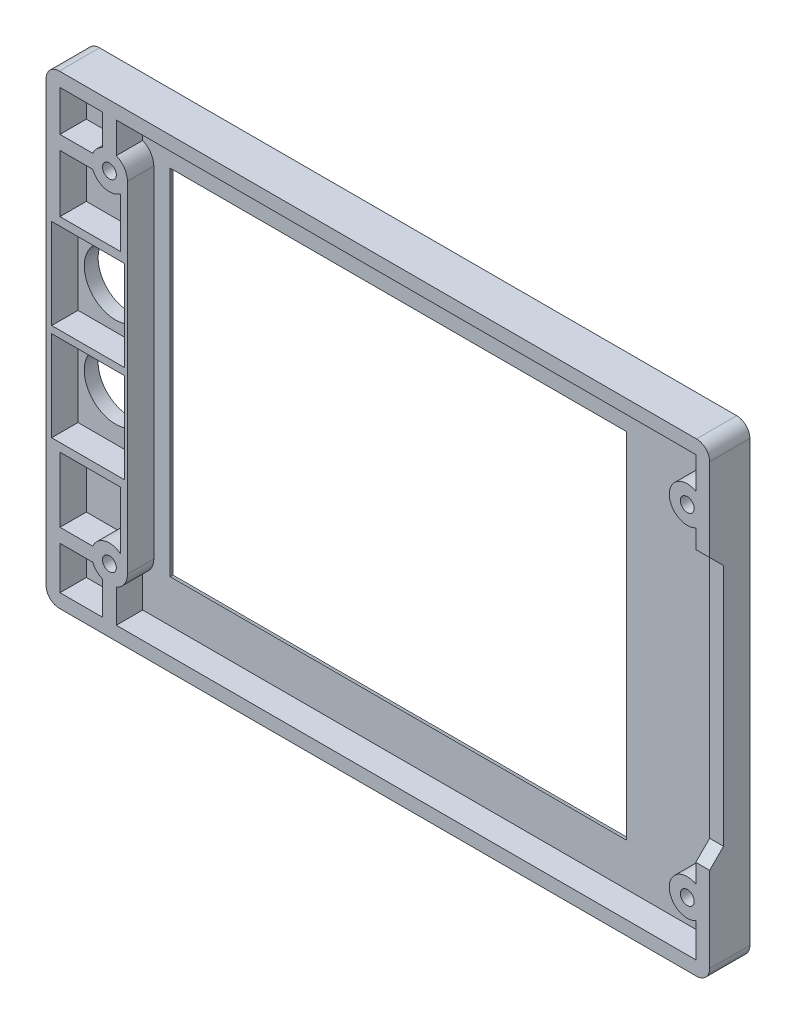
from build123d import *

# Parameters (mm, degrees)
AUFSATZ_LINEAR_AUSTRAGEN1_DEPTH       = 2
SKIZZE3_W                             = 65.8
SKIZZE3_H                             = 51
SCHNITT_LINEAR_AUSTRAGEN1_DEPTH       = 2
SKIZZE4_R                             = 2.6
SKIZZE4_R_2                           = 1
LINEAR_AUSTRAGEN_D_NN1_DEPTH          = 3.8
SKIZZE9_R                             = 4.5
SCHNITT_LINEAR_AUSTRAGEN3_DEPTH       = 2
SKIZZE14_W                            = 2
SKIZZE14_H                            = 51
AUFSATZ_LINEAR_AUSTRAGEN6_DEPTH       = 0.8
SKIZZE15_W                            = 2
SKIZZE15_H                            = 51
SCHNITT_LINEAR_AUSTRAGEN7_DEPTH       = 0.8
SCHNITT_LINEAR_START                  = -0.8
SCHNITT_LINEAR_AUSTRAGEN6_OUTLINE_W   = 0.832
SCHNITT_LINEAR_AUSTRAGEN6_OUTLINE_H   = 4.8
SCHNITT_LINEAR_AUSTRAGEN6_DEPTH       = 1.8
AUFSATZ_LINEAR_START                  = -0.8
AUFSATZ_LINEAR_AUSTRAGEN5_DEPTH       = 0.8
AUFSATZ_LINEAR_AUSTRAGEN5_2_OUTLINE_W = 0.832
AUFSATZ_LINEAR_AUSTRAGEN5_2_OUTLINE_H = 4.8
AUFSATZ_LINEAR_AUSTRAGEN5_2_DEPTH     = 0.8
AUFSATZ_LINEAR_AUSTRAGEN5_3_DEPTH     = 0.8
SKIZZE16_W                            = 69.8
SKIZZE16_H                            = 55
SKIZZE16_W_2                          = 65.8
SKIZZE16_H_2                          = 51
SCHNITT_LINEAR_AUSTRAGEN8_DEPTH       = 1.8
SKIZZE16_2_W                          = 69.8
SKIZZE16_2_H                          = 55
SKIZZE16_2_W_2                        = 65.8
SKIZZE16_2_H_2                        = 51
AUFSATZ_LINEAR_AUSTRAGEN7_DEPTH       = 1.8
FASE3_SIZE                            = 1.6
SKIZZE21_W                            = 95.25
SKIZZE21_H                            = 2
AUFSATZ_LINEAR_AUSTRAGEN12_DEPTH      = 0.2
SKIZZE22_W                            = 2
SKIZZE22_H                            = 66.875
AUFSATZ_LINEAR_AUSTRAGEN13_DEPTH      = 0.2
SKIZZE23_W                            = 95.45
SKIZZE23_H                            = 2
AUFSATZ_LINEAR_AUSTRAGEN14_DEPTH      = 0.2
SKIZZE24_W                            = 2
SKIZZE24_H                            = 67.075
AUFSATZ_LINEAR_AUSTRAGEN15_DEPTH      = 0.2
VERRUNDUNG1_R                         = 1.9
SKIZZE25_W                            = 91.65
SKIZZE25_H                            = 63.075
LINEAR_AUSTRAGEN_D_NN2_DEPTH          = 3.8
SKIZZE26_W                            = 6.123167254
SKIZZE26_H                            = 2
SKIZZE26_W_2                          = 2
SKIZZE26_H_2                          = 5.859879325
SKIZZE26_H_3                          = 6.16886128
SKIZZE26_W_3                          = 0.4
SKIZZE26_H_4                          = 49.045433533
AUFSATZ_LINEAR_AUSTRAGEN16_DEPTH      = 3.8
SKIZZE27_W                            = 1.2
SKIZZE27_H                            = 27.007076655
SCHNITT_LINEAR_AUSTRAGEN9_DEPTH       = 3.8
SKIZZE28_W                            = 9.523167254
SKIZZE28_H                            = 1.2
SKIZZE28_W_2                          = 9.323167254
AUFSATZ_LINEAR_AUSTRAGEN17_DEPTH      = 3.8
SKIZZE29_W                            = 10.523167254
SKIZZE29_H                            = 1.007076655
AUFSATZ_LINEAR_AUSTRAGEN18_DEPTH      = 3.8
SKIZZE32_W                            = 2
SKIZZE32_H                            = 35.046259395
SCHNITT_LINEAR_AUSTRAGEN10_DEPTH      = 2
FASE4_SIZE                            = 2
SKIZZE33_W                            = 0.6
SKIZZE33_H                            = 8.082666584
SKIZZE33_H_2                          = 9.131924744
AUFSATZ_LINEAR_AUSTRAGEN19_DEPTH      = 3.8


with BuildPart() as part:
    # Skizze2 → Aufsatz-Linear austragen1 (new body)
    with BuildSketch(Plane.XY):
        Polygon((-84.803910283, -35.982715869), (6.159856384, -35.982715869), (8.38232305, -35.982715869), (8.38232305, -33.918949203), (8.38232305, 28.628517464), (8.38232305, 30.692284131), (6.318589717, 30.692284131), (-84.803910283, 30.692284131), (-86.86767695, 30.692284131), (-86.86767695, 28.628517464), (-86.86767695, -33.918949203), (-86.86767695, -35.982715869), align=None)
    extrude(amount=AUFSATZ_LINEAR_AUSTRAGEN1_DEPTH)

    # Skizze3 → Schnitt-Linear austragen1 (cut)
    with BuildSketch(Plane(origin=(0, 0, 0), x_dir=(-1, 0, 0), z_dir=(0, 0, -1))):
        with Locations((39.27767695, -2.538949203)):
            Rectangle(SKIZZE3_W, SKIZZE3_H)
    extrude(amount=-SCHNITT_LINEAR_AUSTRAGEN1_DEPTH, mode=Mode.SUBTRACT)

    # Skizze4 → Linear-Austragen-Dünn1 (add)
    # profile 1 of 4: a face of its own
    with BuildSketch(Plane.XY.offset(2)):
        with Locations((-77.944509696, 22.032404806)):
            Circle(SKIZZE4_R)
        with Locations((-77.944509696, 22.032404806)):
            Circle(SKIZZE4_R_2, mode=Mode.SUBTRACT)
    # profile 2 of 4: a face of its own
    with BuildSketch(Plane.XY.offset(2)):
        with Locations((-77.944509696, -27.013854589)):
            Circle(SKIZZE4_R)
        with Locations((-77.944509696, -27.013854589)):
            Circle(SKIZZE4_R_2, mode=Mode.SUBTRACT)
    # profile 3 of 4: a face of its own
    with BuildSketch(Plane.XY.offset(2)):
        with Locations((5.358600488, -27.013854589)):
            Circle(SKIZZE4_R)
        with Locations((5.358600488, -27.013854589)):
            Circle(SKIZZE4_R_2, mode=Mode.SUBTRACT)
    # profile 4 of 4: a face of its own
    with BuildSketch(Plane.XY.offset(2)):
        with Locations((5.358600488, 22.032404806)):
            Circle(SKIZZE4_R)
        with Locations((5.358600488, 22.032404806)):
            Circle(SKIZZE4_R_2, mode=Mode.SUBTRACT)
    extrude(amount=LINEAR_AUSTRAGEN_D_NN1_DEPTH)

    # Skizze9 → Schnitt-Linear austragen3 (cut)
    with BuildSketch(Plane.XY.offset(2)):
        with Locations((-80.86767695, 4.567589342)):
            Circle(SKIZZE9_R)
        with Locations((-80.86767695, -8.439487313)):
            Circle(SKIZZE9_R)
    extrude(amount=-SCHNITT_LINEAR_AUSTRAGEN3_DEPTH, mode=Mode.SUBTRACT)

    # Skizze14 → Aufsatz-Linear austragen6 (add)
    with BuildSketch(Plane.ZY.offset(6.37767695)):
        with Locations((1, -2.538949203)):
            Rectangle(SKIZZE14_W, SKIZZE14_H)
    extrude(amount=AUFSATZ_LINEAR_AUSTRAGEN6_DEPTH)

    # Skizze15 → Schnitt-Linear austragen7 (cut)
    with BuildSketch(Plane(origin=(-72.17767695, 0, 0), x_dir=(0, 0, -1), z_dir=(1, 0, 0))):
        with Locations((-1, -2.538949203)):
            Rectangle(SKIZZE15_W, SKIZZE15_H)
    extrude(amount=-SCHNITT_LINEAR_AUSTRAGEN7_DEPTH, mode=Mode.SUBTRACT)

    # Schnitt-Linear austragen6: read off the stored shape, not the designer's step
    # Schnitt-Linear austragen6 outline → Schnitt-Linear austragen6 (cut)
    # profile 1 of 3: a face of its own
    with BuildSketch(Plane(origin=(0, 0, 0), x_dir=(-1, 0, 0), z_dir=(0, 0, -1)).offset(SCHNITT_LINEAR_START)):
        with BuildLine():
            add(Edge.make_bspline(
                [(41.781767782, -34.797276997), (41.767178521, -34.762910345), (41.737075659, -34.691999652), (41.68900459, -34.583021504), (41.636856474, -34.468236667), (41.581670084, -34.346987974), (41.523757347, -34.218948594), (41.462532171, -34.08419863), (41.399774132, -33.94193969), (41.312065058, -33.743850082), (41.200314409, -33.493806205), (41.056118353, -33.201433241), (40.914209117, -32.917053322), (40.800807681, -32.685582439), (40.715021172, -32.506824871), (40.652268758, -32.382022082), (40.592207512, -32.263881564), (40.542395149, -32.171631198), (40.511571239, -32.10832599), (40.500095841, -32.082007826), (40.496573283, -32.07324744)],
                knots=[0, 0, 0, 0, 0.034500563, 0.071187, 0.110063316, 0.15100446, 0.194290954, 0.239922853, 0.287774458, 0.337971758, 0.440120704, 0.540825287, 0.639182399, 0.733823363, 0.779010204, 0.822402877, 0.862904814, 0.901482229, 0.919254697, 0.927976768, 0.927976768, 0.927976768, 0.927976768], degree=3))
            Line((41.781767782, -34.797276997), (42.436767782, -34.797276997))
            add(Edge.make_bspline(
                [(43.727068321, -32.055392545), (43.724709244, -32.061052824), (43.7140306, -32.085712277), (43.66141433, -32.191444947), (43.564353233, -32.377568897), (43.438789812, -32.639283129), (43.306042939, -32.909918323), (43.164344424, -33.185220745), (43.021662079, -33.473725436), (42.909809433, -33.726093258), (42.821913046, -33.931670735), (42.758561654, -34.079440123), (42.696224093, -34.217485326), (42.636890444, -34.346514045), (42.581717997, -34.468254432), (42.529521444, -34.583017153), (42.481462069, -34.69200064), (42.451357749, -34.762910667), (42.436767782, -34.797276997)],
                knots=[0.069075624, 0.069075624, 0.069075624, 0.069075624, 0.074722211, 0.093815852, 0.177875914, 0.268118698, 0.361243693, 0.455604817, 0.553401566, 0.65774291, 0.709886229, 0.759408515, 0.805872658, 0.849438848, 0.8902598, 0.929021986, 0.965600721, 1, 1, 1, 1], degree=3))
            add(Edge.make_bspline(
                [(43.874767782, -35.437276997), (43.869206987, -35.271939875), (43.858196974, -34.944583102), (43.839988093, -34.45825618), (43.821518099, -33.981883387), (43.799991289, -33.517599709), (43.779366029, -33.069915199), (43.758343176, -32.64324796), (43.74096898, -32.3076255), (43.730341271, -32.11435187), (43.727068321, -32.055392545)],
                knots=[0, 0, 0, 0, 0.138334797, 0.273893922, 0.406956967, 0.536980294, 0.66254851, 0.781713115, 0.894196585, 0.943574943, 0.943574943, 0.943574943, 0.943574943], degree=3))
            Line((43.874767782, -35.437276997), (44.704767782, -35.437276997))
            add(Edge.make_bspline(
                [(44.377767782, -30.637276997), (44.412778202, -31.027192884), (44.483362034, -31.813294775), (44.571456434, -33.003441066), (44.647307638, -34.213493169), (44.685514398, -35.027219202), (44.704767782, -35.437276997)],
                knots=[0, 0, 0, 0, 0.244084907, 0.492094869, 0.744053343, 1, 1, 1, 1], degree=3))
            Line((44.377767782, -30.637276997), (43.644767782, -30.637276997))
            add(Edge.make_bspline(
                [(42.109767782, -33.901276997), (42.124368739, -33.844061814), (42.154875071, -33.724519966), (42.217716783, -33.541587917), (42.292142004, -33.344915111), (42.416826947, -33.064575814), (42.587721513, -32.698931409), (42.794566954, -32.250266287), (43.006165613, -31.806672168), (43.188077148, -31.450398651), (43.330370731, -31.179304014), (43.437125037, -30.990250354), (43.539211224, -30.809104194), (43.610083496, -30.693736811), (43.644767782, -30.637276997)],
                knots=[0, 0, 0, 0, 0.048991334, 0.102359448, 0.160419925, 0.223485875, 0.356930682, 0.495438602, 0.633536698, 0.764814667, 0.827438497, 0.887631747, 0.945007934, 1, 1, 1, 1], degree=3))
            add(Edge.make_bspline(
                [(40.569767782, -30.637276997), (40.643406299, -30.75971941), (40.794466044, -31.010893937), (41.008232891, -31.408597076), (41.222883356, -31.83296366), (41.430856449, -32.278620858), (41.636306445, -32.723831667), (41.804622311, -33.082914019), (41.927587611, -33.35506653), (42.002140804, -33.54610218), (42.064914778, -33.726092832), (42.095201159, -33.844383558), (42.109767782, -33.901276997)],
                knots=[0, 0, 0, 0, 0.118514609, 0.243117155, 0.374451296, 0.51299163, 0.651063123, 0.781216145, 0.842002695, 0.898745008, 0.951300115, 1, 1, 1, 1], degree=3))
            Line((40.569767782, -30.637276997), (39.846767782, -30.637276997))
            add(Edge.make_bspline(
                [(39.520767782, -35.437276997), (39.529600457, -35.217603909), (39.546892349, -34.787545822), (39.57524477, -34.153114848), (39.610026423, -33.537821554), (39.647203055, -32.936055916), (39.69130182, -32.347525422), (39.73495228, -31.770595085), (39.787641155, -31.202300292), (39.8270637, -30.825572292), (39.846767782, -30.637276997)],
                knots=[0, 0, 0, 0, 0.137063101, 0.268330979, 0.395915623, 0.521267524, 0.644201892, 0.763852071, 0.881969103, 1, 1, 1, 1], degree=3))
            Line((39.520767782, -35.437276997), (40.348767782, -35.437276997))
            add(Edge.make_bspline(
                [(40.496573283, -32.07324744), (40.493646637, -32.125924363), (40.483251143, -32.312594005), (40.464670472, -32.641536303), (40.444720671, -33.067957758), (40.421747441, -33.515865679), (40.402541593, -33.980588209), (40.383381901, -34.457582281), (40.36539901, -34.94425229), (40.354345084, -35.271940582), (40.348767782, -35.437276997)],
                knots=[0.061407132, 0.061407132, 0.061407132, 0.061407132, 0.105523386, 0.217741555, 0.336904218, 0.462483689, 0.592771123, 0.725832, 0.861667458, 1, 1, 1, 1], degree=3))
        make_face()
    # profile 2 of 3: a face of its own
    with BuildSketch(Plane(origin=(0, 0, 0), x_dir=(-1, 0, 0), z_dir=(0, 0, -1)).offset(SCHNITT_LINEAR_START)):
        with BuildLine():
            add(Edge.make_bspline(
                [(37.024767782, -34.020276997), (37.023041717, -34.078706388), (37.019680043, -34.192503145), (36.993491208, -34.357781205), (36.949253883, -34.512192159), (36.887815919, -34.6563045), (36.809874627, -34.790506098), (36.712176166, -34.912703015), (36.597143013, -35.023922297), (36.465464686, -35.125644295), (36.314732072, -35.215220179), (36.144285865, -35.291598702), (35.954774811, -35.357934827), (35.744913577, -35.409487965), (35.516316425, -35.45209988), (35.267635906, -35.47959326), (34.999387473, -35.498267405), (34.813803423, -35.500250691), (34.717767782, -35.501276997)],
                knots=[0, 0, 0, 0, 0.056482685, 0.110005363, 0.161321016, 0.21143305, 0.261131827, 0.31091833, 0.362205629, 0.415524093, 0.471467074, 0.531328948, 0.595857409, 0.665357197, 0.740085456, 0.820568524, 0.90714818, 1, 1, 1, 1], degree=3))
            add(Edge.make_bspline(
                [(36.097767782, -32.879276997), (36.160736064, -32.896076951), (36.284895069, -32.929202605), (36.458940701, -33.011040301), (36.617624289, -33.117248079), (36.736052489, -33.22521722), (36.820047793, -33.323216291), (36.875766381, -33.403599991), (36.921394355, -33.491282472), (36.959832702, -33.584501244), (36.988671929, -33.68452007), (37.009319583, -33.79059992), (37.022929269, -33.903259409), (37.024143914, -33.980569105), (37.024767782, -34.020276997)],
                knots=[0, 0, 0, 0, 0.121814417, 0.240190081, 0.358054742, 0.478193697, 0.538840609, 0.599423276, 0.660835881, 0.723528706, 0.787904017, 0.855337151, 0.925698107, 1, 1, 1, 1], degree=3))
            add(Edge.make_bspline(
                [(36.768767782, -31.850276997), (36.768226693, -31.883301472), (36.767164291, -31.948143387), (36.75777347, -32.043319345), (36.743587007, -32.134492702), (36.720446511, -32.220944869), (36.694710929, -32.304236034), (36.659353803, -32.382348611), (36.621454986, -32.457965641), (36.560095122, -32.548987228), (36.477153058, -32.65233148), (36.361797607, -32.753029866), (36.236114196, -32.832601223), (36.143900672, -32.863712529), (36.097767782, -32.879276997)],
                knots=[0, 0, 0, 0, 0.075069779, 0.147395781, 0.217298381, 0.284579583, 0.350732823, 0.415223943, 0.479295037, 0.542780666, 0.664475486, 0.779411673, 0.889643335, 1, 1, 1, 1], degree=3))
            add(Edge.make_bspline(
                [(34.701767782, -30.509276997), (34.771456211, -30.509933692), (34.908958677, -30.511229418), (35.112463032, -30.524868406), (35.310280055, -30.545795152), (35.502233779, -30.573743075), (35.685364313, -30.613575769), (35.858715133, -30.663489853), (36.018808177, -30.729348257), (36.167613857, -30.804973759), (36.30346478, -30.892469706), (36.422995007, -30.993824192), (36.526151688, -31.10733618), (36.61415565, -31.231618292), (36.683628007, -31.369011786), (36.73413821, -31.518327668), (36.763179713, -31.680486713), (36.766866016, -31.792492925), (36.768767782, -31.850276997)],
                knots=[0, 0, 0, 0, 0.075266066, 0.148507721, 0.220199213, 0.290114618, 0.357912835, 0.422508022, 0.484689871, 0.544593957, 0.602617069, 0.658816235, 0.71336009, 0.767900379, 0.822810228, 0.879057817, 0.937605855, 1, 1, 1, 1], degree=3))
            add(Edge.make_bspline(
                [(33.376767782, -30.639276997), (33.436259319, -30.625069695), (33.55190271, -30.597452646), (33.724983979, -30.571393922), (33.893570254, -30.552683696), (34.060650897, -30.537819774), (34.227009563, -30.525808914), (34.391039688, -30.517023687), (34.549050124, -30.510515777), (34.652095159, -30.50967992), (34.701767782, -30.509276997)],
                knots=[0, 0, 0, 0, 0.137483649, 0.267249366, 0.393236393, 0.518919793, 0.644422007, 0.768286162, 0.888302876, 1, 1, 1, 1], degree=3))
            Line((33.376767782, -30.639276997), (33.376767782, -35.372276997))
            add(Edge.make_bspline(
                [(34.717767782, -35.501276997), (34.667432594, -35.50076365), (34.562741282, -35.499695948), (34.401676713, -35.494991078), (34.234733385, -35.485255087), (34.06586926, -35.475526459), (33.897643349, -35.45839903), (33.727971994, -35.440306444), (33.553602066, -35.413965447), (33.43693083, -35.386460356), (33.376767782, -35.372276997)],
                knots=[0, 0, 0, 0, 0.111862353, 0.232660631, 0.358023979, 0.483474835, 0.608483151, 0.733721695, 0.862690113, 1, 1, 1, 1], degree=3))
        make_face()
        with BuildLine():
            add(Edge.make_bspline(
                [(36.128767782, -34.009276997), (36.127864675, -33.975559408), (36.126129094, -33.91076128), (36.111320181, -33.817463634), (36.084865546, -33.733023365), (36.050182022, -33.655743235), (36.004152753, -33.587512816), (35.95077899, -33.525270706), (35.887288218, -33.471143259), (35.814102304, -33.425064157), (35.732351369, -33.385356112), (35.642058895, -33.349708948), (35.541527012, -33.322707718), (35.432988659, -33.299979244), (35.316874428, -33.281674666), (35.194250558, -33.270762403), (35.065566324, -33.261732027), (34.977785855, -33.26143125), (34.932767782, -33.261276997)],
                knots=[0, 0, 0, 0, 0.063080271, 0.121227035, 0.176078291, 0.228272304, 0.279137277, 0.329545019, 0.381304823, 0.43460174, 0.49095413, 0.551191371, 0.615969827, 0.685460504, 0.758686496, 0.835777345, 0.915778674, 1, 1, 1, 1], degree=3))
            add(Edge.make_bspline(
                [(34.741767782, -34.797276997), (34.83582385, -34.795544153), (35.017649882, -34.792194277), (35.240300408, -34.770621367), (35.406672409, -34.743355501), (35.520859539, -34.71512809), (35.626726519, -34.681364163), (35.72397329, -34.640532237), (35.812761397, -34.592481929), (35.892775646, -34.536577455), (35.961709869, -34.470932002), (36.022184615, -34.398246917), (36.070910273, -34.315611265), (36.104835475, -34.222092855), (36.12489827, -34.118796291), (36.127445437, -34.046703511), (36.128767782, -34.009276997)],
                knots=[0, 0, 0, 0, 0.156965442, 0.303440323, 0.372859295, 0.438166107, 0.499567093, 0.558153876, 0.613920414, 0.667792753, 0.720529955, 0.772316646, 0.825176949, 0.87974286, 0.937569261, 1, 1, 1, 1], degree=3))
            add(Edge.make_bspline(
                [(34.265767782, -34.784276997), (34.297095202, -34.786365522), (34.364713445, -34.790873469), (34.474710587, -34.796187511), (34.602098516, -34.797617025), (34.693102039, -34.797395475), (34.741767782, -34.797276997)],
                knots=[0, 0, 0, 0, 0.197747242, 0.426824833, 0.693484441, 1, 1, 1, 1], degree=3))
            add(Edge.make_bspline(
                [(34.208767782, -34.779955242), (34.214233584, -34.780223771), (34.23117798, -34.784588076), (34.251223591, -34.784407798), (34.265767782, -34.784276997)],
                knots=[0.304058267, 0.304058267, 0.304058267, 0.304058267, 0.4950561, 1, 1, 1, 1], degree=3))
            Line((34.208767782, -34.779955242), (34.208767782, -33.261276997))
            Line((34.208767782, -33.261276997), (34.932767782, -33.261276997))
        make_face(mode=Mode.SUBTRACT)
        with BuildLine():
            add(Edge.make_bspline(
                [(34.726767782, -31.213276997), (34.687765744, -31.213063034), (34.614422107, -31.212660676), (34.511433129, -31.215283869), (34.422083755, -31.216949843), (34.347066391, -31.219505549), (34.287825113, -31.224001096), (34.245354709, -31.222965832), (34.221132691, -31.226396702), (34.210768583, -31.226296367), (34.208767782, -31.226276997)],
                knots=[0, 0, 0, 0, 0.225752014, 0.42452843, 0.596297675, 0.743054212, 0.858969098, 0.94003125, 0.988422974, 1, 1, 1, 1], degree=3))
            add(Edge.make_bspline(
                [(35.872767782, -31.910276997), (35.871963101, -31.879534765), (35.870411604, -31.820260993), (35.854177746, -31.735301528), (35.827218868, -31.658355388), (35.789216507, -31.589435693), (35.742918579, -31.526395044), (35.686229415, -31.470710113), (35.621695796, -31.420012719), (35.547985285, -31.376387848), (35.466870685, -31.337644661), (35.378464858, -31.303219424), (35.282512816, -31.275973598), (35.143698071, -31.244823888), (34.957724231, -31.218380148), (34.805202644, -31.215010073), (34.726767782, -31.213276997)],
                knots=[0, 0, 0, 0, 0.061230011, 0.118056936, 0.17165631, 0.223103091, 0.274408032, 0.327038726, 0.381011705, 0.4376557, 0.497399864, 0.560094599, 0.626550886, 0.696038234, 0.843686395, 1, 1, 1, 1], degree=3))
            add(Edge.make_bspline(
                [(34.766767782, -32.621276997), (34.843164255, -32.619866242), (34.991394756, -32.617128982), (35.172424132, -32.596363269), (35.307458926, -32.5701847), (35.399451982, -32.543184797), (35.484046971, -32.509962805), (35.561799613, -32.471537416), (35.630634363, -32.424617202), (35.693908246, -32.374319248), (35.746490159, -32.31534859), (35.79327749, -32.251631367), (35.829041646, -32.178871398), (35.855545497, -32.097518877), (35.870102559, -32.006797854), (35.871855177, -31.943326907), (35.872767782, -31.910276997)],
                knots=[0, 0, 0, 0, 0.153556136, 0.297941804, 0.365626147, 0.429879452, 0.490359537, 0.54820176, 0.603775082, 0.65757459, 0.710226603, 0.762109619, 0.81605501, 0.872426661, 0.933571381, 1, 1, 1, 1], degree=3))
            Line((34.766767782, -32.621276997), (34.208767782, -32.621276997))
            Line((34.208767782, -32.621276997), (34.208767782, -31.226276997))
        make_face(mode=Mode.SUBTRACT)
    # profile 3 of 3: a face of its own
    with BuildSketch(Plane(origin=(0, 0, 0), x_dir=(-1, 0, 0), z_dir=(0, 0, -1)).offset(SCHNITT_LINEAR_START)):
        with Locations((38.272767782, -33.037276997)):
            Rectangle(SCHNITT_LINEAR_AUSTRAGEN6_OUTLINE_W, SCHNITT_LINEAR_AUSTRAGEN6_OUTLINE_H)
    extrude(amount=SCHNITT_LINEAR_AUSTRAGEN6_DEPTH, mode=Mode.SUBTRACT)

    # Skizze16 → Schnitt-Linear austragen8 (cut)
    with BuildSketch(Plane(origin=(0, 0, 0), x_dir=(-1, 0, 0), z_dir=(0, 0, -1))):
        with Locations((40.07767695, -2.538949203)):
            Rectangle(SKIZZE16_W, SKIZZE16_H)
        with Locations((40.07767695, -2.538949203)):
            Rectangle(SKIZZE16_W_2, SKIZZE16_H_2, mode=Mode.SUBTRACT)
    extrude(amount=-SCHNITT_LINEAR_AUSTRAGEN8_DEPTH, mode=Mode.SUBTRACT)

    # Skizze21 → Aufsatz-Linear austragen12 (add)
    with BuildSketch(Plane(origin=(0, 30.692284131, 0), x_dir=(1, 0, 0), z_dir=(0, 1, 0))):
        with Locations((-39.24267695, -1)):
            Rectangle(SKIZZE21_W, SKIZZE21_H)
    extrude(amount=AUFSATZ_LINEAR_AUSTRAGEN12_DEPTH)

    # Skizze22 → Aufsatz-Linear austragen13 (add)
    with BuildSketch(Plane.ZY.offset(86.86767695)):
        with Locations((1, -2.545215869)):
            Rectangle(SKIZZE22_W, SKIZZE22_H)
    extrude(amount=AUFSATZ_LINEAR_AUSTRAGEN13_DEPTH)

    # Skizze23 → Aufsatz-Linear austragen14 (add)
    with BuildSketch(Plane.XZ.offset(35.982715869)):
        with Locations((-39.34267695, 1)):
            Rectangle(SKIZZE23_W, SKIZZE23_H)
    extrude(amount=AUFSATZ_LINEAR_AUSTRAGEN14_DEPTH)

    # Skizze24 → Aufsatz-Linear austragen15 (add)
    with BuildSketch(Plane(origin=(8.38232305, 0, 0), x_dir=(0, 0, -1), z_dir=(1, 0, 0))):
        with Locations((-1, -2.645215869)):
            Rectangle(SKIZZE24_W, SKIZZE24_H)
    extrude(amount=AUFSATZ_LINEAR_AUSTRAGEN15_DEPTH)

    # Verrundung1
    verrundung1_edges = [part.edges().sort_by_distance(p)[0] for p in [
        (-87.06767695, 30.892284131, 1),
        (-87.06767695, -36.182715869, 1),
        (8.58232305, -36.182715869, 1),
        (8.58232305, 30.892284131, 1),
    ]]
    fillet(verrundung1_edges, radius=VERRUNDUNG1_R)

    # Skizze25 → Linear-Austragen-Dünn2 (add)
    with BuildSketch(Plane.XY.offset(2)):
        with BuildLine():
            Line((6.68232305, 30.892284131), (-85.16767695, 30.892284131))
            ThreePointArc((-85.16767695, 30.892284131), (-86.511179834, 30.335787015), (-87.06767695, 28.992284131))
            Line((-87.06767695, 28.992284131), (-87.06767695, -34.282715869))
            ThreePointArc((-87.06767695, -34.282715869), (-86.511179834, -35.626218754), (-85.16767695, -36.182715869))
            Line((-85.16767695, -36.182715869), (6.68232305, -36.182715869))
            ThreePointArc((6.68232305, -36.182715869), (8.025825935, -35.626218754), (8.58232305, -34.282715869))
            Line((8.58232305, -34.282715869), (8.58232305, 28.992284131))
            ThreePointArc((8.58232305, 28.992284131), (8.025825935, 30.335787015), (6.68232305, 30.892284131))
        make_face()
        with Locations((-39.24267695, -2.645215869)):
            Rectangle(SKIZZE25_W, SKIZZE25_H, mode=Mode.SUBTRACT)
    extrude(amount=LINEAR_AUSTRAGEN_D_NN2_DEPTH)

    # Skizze26 → Aufsatz-Linear austragen16 (add)
    with BuildSketch(Plane.XY.offset(2)):
        with Locations((-83.006093323, 22.032404806)):
            Rectangle(SKIZZE26_W, SKIZZE26_H)
        with Locations((-77.944509696, 26.962344468)):
            Rectangle(SKIZZE26_W_2, SKIZZE26_H_2)
        with Locations((-77.944509696, -32.098285229)):
            Rectangle(SKIZZE26_W_2, SKIZZE26_H_3)
        with Locations((-83.006093323, -27.013854589)):
            Rectangle(SKIZZE26_W, SKIZZE26_H)
        with Locations((-75.544509696, -2.49031196)):
            Rectangle(SKIZZE26_W_3, SKIZZE26_H_4)
    extrude(amount=AUFSATZ_LINEAR_AUSTRAGEN16_DEPTH)

    # Skizze27 → Schnitt-Linear austragen9 (cut)
    with BuildSketch(Plane.XY.offset(5.8)):
        with Locations((-85.66767695, -1.935948985)):
            Rectangle(SKIZZE27_W, SKIZZE27_H)
    extrude(amount=-SCHNITT_LINEAR_AUSTRAGEN9_DEPTH, mode=Mode.SUBTRACT)

    # Skizze28 → Aufsatz-Linear austragen17 (add)
    with BuildSketch(Plane.XY.offset(2)):
        with Locations((-80.506093323, -16.039487313)):
            Rectangle(SKIZZE28_W, SKIZZE28_H)
        with Locations((-80.406093323, 12.167589342)):
            Rectangle(SKIZZE28_W_2, SKIZZE28_H)
    extrude(amount=AUFSATZ_LINEAR_AUSTRAGEN17_DEPTH)

    # Skizze29 → Aufsatz-Linear austragen18 (add)
    with BuildSketch(Plane.XY.offset(2)):
        with Locations((-81.006093323, -1.935948986)):
            Rectangle(SKIZZE29_W, SKIZZE29_H)
    extrude(amount=AUFSATZ_LINEAR_AUSTRAGEN18_DEPTH)

    # Skizze32 → Schnitt-Linear austragen10 (cut)
    with BuildSketch(Plane.XY.offset(5.8)):
        with Locations((7.58232305, -2.490724892)):
            Rectangle(SKIZZE32_W, SKIZZE32_H)
    extrude(amount=-SCHNITT_LINEAR_AUSTRAGEN10_DEPTH, mode=Mode.SUBTRACT)

    # Fase4
    fase4_edges = [part.edges().sort_by_distance(p)[0] for p in [
        (7.58232305, -20.013854589, 5.8),
        (7.58232305, 15.032404806, 5.8),
    ]]
    chamfer(fase4_edges, length=FASE4_SIZE - 0.0001)  # a hair under: the kernel refuses the full size

    # Skizze33 → Aufsatz-Linear austragen19 (add)
    with BuildSketch(Plane.XY.offset(2)):
        with Locations((-76.044509696, 16.808922634)):
            Rectangle(SKIZZE33_W, SKIZZE33_H)
        with Locations((-76.044509696, -21.205449685)):
            Rectangle(SKIZZE33_W, SKIZZE33_H_2)
    extrude(amount=AUFSATZ_LINEAR_AUSTRAGEN19_DEPTH)


with BuildPart() as body_2:
    # Aufsatz-Linear austragen5: read off the stored shape, not the designer's step
    # Aufsatz-Linear austragen5 outline → Aufsatz-Linear austragen5 (new body)
    with BuildSketch(Plane(origin=(0, 0, 0), x_dir=(-1, 0, 0), z_dir=(0, 0, -1)).offset(AUFSATZ_LINEAR_START)):
        with BuildLine():
            Line((41.781767782, -34.797276997), (42.436767782, -34.797276997))
            add(Edge.make_bspline(
                [(43.727068321, -32.055392545), (43.724709244, -32.061052824), (43.7140306, -32.085712277), (43.66141433, -32.191444947), (43.564353233, -32.377568897), (43.438789812, -32.639283129), (43.306042939, -32.909918323), (43.164344424, -33.185220745), (43.021662079, -33.473725436), (42.909809433, -33.726093258), (42.821913046, -33.931670735), (42.758561654, -34.079440123), (42.696224093, -34.217485326), (42.636890444, -34.346514045), (42.581717997, -34.468254432), (42.529521444, -34.583017153), (42.481462069, -34.69200064), (42.451357749, -34.762910667), (42.436767782, -34.797276997)],
                knots=[0.069075624, 0.069075624, 0.069075624, 0.069075624, 0.074722211, 0.093815852, 0.177875914, 0.268118698, 0.361243693, 0.455604817, 0.553401566, 0.65774291, 0.709886229, 0.759408515, 0.805872658, 0.849438848, 0.8902598, 0.929021986, 0.965600721, 1, 1, 1, 1], degree=3))
            add(Edge.make_bspline(
                [(43.874767782, -35.437276997), (43.869206987, -35.271939875), (43.858196974, -34.944583102), (43.839988093, -34.45825618), (43.821518099, -33.981883387), (43.799991289, -33.517599709), (43.779366029, -33.069915199), (43.758343176, -32.64324796), (43.74096898, -32.3076255), (43.730341271, -32.11435187), (43.727068321, -32.055392545)],
                knots=[0, 0, 0, 0, 0.138334797, 0.273893922, 0.406956967, 0.536980294, 0.66254851, 0.781713115, 0.894196585, 0.943574943, 0.943574943, 0.943574943, 0.943574943], degree=3))
            Line((43.874767782, -35.437276997), (44.704767782, -35.437276997))
            add(Edge.make_bspline(
                [(44.377767782, -30.637276997), (44.412778202, -31.027192884), (44.483362034, -31.813294775), (44.571456434, -33.003441066), (44.647307638, -34.213493169), (44.685514398, -35.027219202), (44.704767782, -35.437276997)],
                knots=[0, 0, 0, 0, 0.244084907, 0.492094869, 0.744053343, 1, 1, 1, 1], degree=3))
            Line((44.377767782, -30.637276997), (43.644767782, -30.637276997))
            add(Edge.make_bspline(
                [(42.109767782, -33.901276997), (42.124368739, -33.844061814), (42.154875071, -33.724519966), (42.217716783, -33.541587917), (42.292142004, -33.344915111), (42.416826947, -33.064575814), (42.587721513, -32.698931409), (42.794566954, -32.250266287), (43.006165613, -31.806672168), (43.188077148, -31.450398651), (43.330370731, -31.179304014), (43.437125037, -30.990250354), (43.539211224, -30.809104194), (43.610083496, -30.693736811), (43.644767782, -30.637276997)],
                knots=[0, 0, 0, 0, 0.048991334, 0.102359448, 0.160419925, 0.223485875, 0.356930682, 0.495438602, 0.633536698, 0.764814667, 0.827438497, 0.887631747, 0.945007934, 1, 1, 1, 1], degree=3))
            add(Edge.make_bspline(
                [(40.569767782, -30.637276997), (40.643406299, -30.75971941), (40.794466044, -31.010893937), (41.008232891, -31.408597076), (41.222883356, -31.83296366), (41.430856449, -32.278620858), (41.636306445, -32.723831667), (41.804622311, -33.082914019), (41.927587611, -33.35506653), (42.002140804, -33.54610218), (42.064914778, -33.726092832), (42.095201159, -33.844383558), (42.109767782, -33.901276997)],
                knots=[0, 0, 0, 0, 0.118514609, 0.243117155, 0.374451296, 0.51299163, 0.651063123, 0.781216145, 0.842002695, 0.898745008, 0.951300115, 1, 1, 1, 1], degree=3))
            Line((40.569767782, -30.637276997), (39.846767782, -30.637276997))
            add(Edge.make_bspline(
                [(39.520767782, -35.437276997), (39.529600457, -35.217603909), (39.546892349, -34.787545822), (39.57524477, -34.153114848), (39.610026423, -33.537821554), (39.647203055, -32.936055916), (39.69130182, -32.347525422), (39.73495228, -31.770595085), (39.787641155, -31.202300292), (39.8270637, -30.825572292), (39.846767782, -30.637276997)],
                knots=[0, 0, 0, 0, 0.137063101, 0.268330979, 0.395915623, 0.521267524, 0.644201892, 0.763852071, 0.881969103, 1, 1, 1, 1], degree=3))
            Line((39.520767782, -35.437276997), (40.348767782, -35.437276997))
            add(Edge.make_bspline(
                [(40.496573283, -32.07324744), (40.493646637, -32.125924363), (40.483251143, -32.312594005), (40.464670472, -32.641536303), (40.444720671, -33.067957758), (40.421747441, -33.515865679), (40.402541593, -33.980588209), (40.383381901, -34.457582281), (40.36539901, -34.94425229), (40.354345084, -35.271940582), (40.348767782, -35.437276997)],
                knots=[0.061407132, 0.061407132, 0.061407132, 0.061407132, 0.105523386, 0.217741555, 0.336904218, 0.462483689, 0.592771123, 0.725832, 0.861667458, 1, 1, 1, 1], degree=3))
            add(Edge.make_bspline(
                [(41.781767782, -34.797276997), (41.767178521, -34.762910345), (41.737075659, -34.691999652), (41.68900459, -34.583021504), (41.636856474, -34.468236667), (41.581670084, -34.346987974), (41.523757347, -34.218948594), (41.462532171, -34.08419863), (41.399774132, -33.94193969), (41.312065058, -33.743850082), (41.200314409, -33.493806205), (41.056118353, -33.201433241), (40.914209117, -32.917053322), (40.800807681, -32.685582439), (40.715021172, -32.506824871), (40.652268758, -32.382022082), (40.592207512, -32.263881564), (40.542395149, -32.171631198), (40.511571239, -32.10832599), (40.500095841, -32.082007826), (40.496573283, -32.07324744)],
                knots=[0, 0, 0, 0, 0.034500563, 0.071187, 0.110063316, 0.15100446, 0.194290954, 0.239922853, 0.287774458, 0.337971758, 0.440120704, 0.540825287, 0.639182399, 0.733823363, 0.779010204, 0.822402877, 0.862904814, 0.901482229, 0.919254697, 0.927976768, 0.927976768, 0.927976768, 0.927976768], degree=3))
        make_face()
    extrude(amount=AUFSATZ_LINEAR_AUSTRAGEN5_DEPTH)


with BuildPart() as body_3:
    # Aufsatz-Linear austragen5 2 outline → Aufsatz-Linear austragen5 2 (new body)
    with BuildSketch(Plane(origin=(0, 0, 0), x_dir=(-1, 0, 0), z_dir=(0, 0, -1)).offset(AUFSATZ_LINEAR_START)):
        with Locations((38.272767782, -33.037276997)):
            Rectangle(AUFSATZ_LINEAR_AUSTRAGEN5_2_OUTLINE_W, AUFSATZ_LINEAR_AUSTRAGEN5_2_OUTLINE_H)
    extrude(amount=AUFSATZ_LINEAR_AUSTRAGEN5_2_DEPTH)


with BuildPart() as body_4:
    # Aufsatz-Linear austragen5 3 outline → Aufsatz-Linear austragen5 3 (new body)
    with BuildSketch(Plane(origin=(0, 0, 0), x_dir=(-1, 0, 0), z_dir=(0, 0, -1)).offset(AUFSATZ_LINEAR_START)):
        with BuildLine():
            add(Edge.make_bspline(
                [(37.024767782, -34.020276997), (37.023041717, -34.078706388), (37.019680043, -34.192503145), (36.993491208, -34.357781205), (36.949253883, -34.512192159), (36.887815919, -34.6563045), (36.809874627, -34.790506098), (36.712176166, -34.912703015), (36.597143013, -35.023922297), (36.465464686, -35.125644295), (36.314732072, -35.215220179), (36.144285865, -35.291598702), (35.954774811, -35.357934827), (35.744913577, -35.409487965), (35.516316425, -35.45209988), (35.267635906, -35.47959326), (34.999387473, -35.498267405), (34.813803423, -35.500250691), (34.717767782, -35.501276997)],
                knots=[0, 0, 0, 0, 0.056482685, 0.110005363, 0.161321016, 0.21143305, 0.261131827, 0.31091833, 0.362205629, 0.415524093, 0.471467074, 0.531328948, 0.595857409, 0.665357197, 0.740085456, 0.820568524, 0.90714818, 1, 1, 1, 1], degree=3))
            add(Edge.make_bspline(
                [(36.097767782, -32.879276997), (36.160736064, -32.896076951), (36.284895069, -32.929202605), (36.458940701, -33.011040301), (36.617624289, -33.117248079), (36.736052489, -33.22521722), (36.820047793, -33.323216291), (36.875766381, -33.403599991), (36.921394355, -33.491282472), (36.959832702, -33.584501244), (36.988671929, -33.68452007), (37.009319583, -33.79059992), (37.022929269, -33.903259409), (37.024143914, -33.980569105), (37.024767782, -34.020276997)],
                knots=[0, 0, 0, 0, 0.121814417, 0.240190081, 0.358054742, 0.478193697, 0.538840609, 0.599423276, 0.660835881, 0.723528706, 0.787904017, 0.855337151, 0.925698107, 1, 1, 1, 1], degree=3))
            add(Edge.make_bspline(
                [(36.768767782, -31.850276997), (36.768226693, -31.883301472), (36.767164291, -31.948143387), (36.75777347, -32.043319345), (36.743587007, -32.134492702), (36.720446511, -32.220944869), (36.694710929, -32.304236034), (36.659353803, -32.382348611), (36.621454986, -32.457965641), (36.560095122, -32.548987228), (36.477153058, -32.65233148), (36.361797607, -32.753029866), (36.236114196, -32.832601223), (36.143900672, -32.863712529), (36.097767782, -32.879276997)],
                knots=[0, 0, 0, 0, 0.075069779, 0.147395781, 0.217298381, 0.284579583, 0.350732823, 0.415223943, 0.479295037, 0.542780666, 0.664475486, 0.779411673, 0.889643335, 1, 1, 1, 1], degree=3))
            add(Edge.make_bspline(
                [(34.701767782, -30.509276997), (34.771456211, -30.509933692), (34.908958677, -30.511229418), (35.112463032, -30.524868406), (35.310280055, -30.545795152), (35.502233779, -30.573743075), (35.685364313, -30.613575769), (35.858715133, -30.663489853), (36.018808177, -30.729348257), (36.167613857, -30.804973759), (36.30346478, -30.892469706), (36.422995007, -30.993824192), (36.526151688, -31.10733618), (36.61415565, -31.231618292), (36.683628007, -31.369011786), (36.73413821, -31.518327668), (36.763179713, -31.680486713), (36.766866016, -31.792492925), (36.768767782, -31.850276997)],
                knots=[0, 0, 0, 0, 0.075266066, 0.148507721, 0.220199213, 0.290114618, 0.357912835, 0.422508022, 0.484689871, 0.544593957, 0.602617069, 0.658816235, 0.71336009, 0.767900379, 0.822810228, 0.879057817, 0.937605855, 1, 1, 1, 1], degree=3))
            add(Edge.make_bspline(
                [(33.376767782, -30.639276997), (33.436259319, -30.625069695), (33.55190271, -30.597452646), (33.724983979, -30.571393922), (33.893570254, -30.552683696), (34.060650897, -30.537819774), (34.227009563, -30.525808914), (34.391039688, -30.517023687), (34.549050124, -30.510515777), (34.652095159, -30.50967992), (34.701767782, -30.509276997)],
                knots=[0, 0, 0, 0, 0.137483649, 0.267249366, 0.393236393, 0.518919793, 0.644422007, 0.768286162, 0.888302876, 1, 1, 1, 1], degree=3))
            Line((33.376767782, -30.639276997), (33.376767782, -35.372276997))
            add(Edge.make_bspline(
                [(34.717767782, -35.501276997), (34.667432594, -35.50076365), (34.562741282, -35.499695948), (34.401676713, -35.494991078), (34.234733385, -35.485255087), (34.06586926, -35.475526459), (33.897643349, -35.45839903), (33.727971994, -35.440306444), (33.553602066, -35.413965447), (33.43693083, -35.386460356), (33.376767782, -35.372276997)],
                knots=[0, 0, 0, 0, 0.111862353, 0.232660631, 0.358023979, 0.483474835, 0.608483151, 0.733721695, 0.862690113, 1, 1, 1, 1], degree=3))
        make_face()
        with BuildLine():
            Line((34.208767782, -33.261276997), (34.932767782, -33.261276997))
            add(Edge.make_bspline(
                [(36.128767782, -34.009276997), (36.127864675, -33.975559408), (36.126129094, -33.91076128), (36.111320181, -33.817463634), (36.084865546, -33.733023365), (36.050182022, -33.655743235), (36.004152753, -33.587512816), (35.95077899, -33.525270706), (35.887288218, -33.471143259), (35.814102304, -33.425064157), (35.732351369, -33.385356112), (35.642058895, -33.349708948), (35.541527012, -33.322707718), (35.432988659, -33.299979244), (35.316874428, -33.281674666), (35.194250558, -33.270762403), (35.065566324, -33.261732027), (34.977785855, -33.26143125), (34.932767782, -33.261276997)],
                knots=[0, 0, 0, 0, 0.063080271, 0.121227035, 0.176078291, 0.228272304, 0.279137277, 0.329545019, 0.381304823, 0.43460174, 0.49095413, 0.551191371, 0.615969827, 0.685460504, 0.758686496, 0.835777345, 0.915778674, 1, 1, 1, 1], degree=3))
            add(Edge.make_bspline(
                [(34.741767782, -34.797276997), (34.83582385, -34.795544153), (35.017649882, -34.792194277), (35.240300408, -34.770621367), (35.406672409, -34.743355501), (35.520859539, -34.71512809), (35.626726519, -34.681364163), (35.72397329, -34.640532237), (35.812761397, -34.592481929), (35.892775646, -34.536577455), (35.961709869, -34.470932002), (36.022184615, -34.398246917), (36.070910273, -34.315611265), (36.104835475, -34.222092855), (36.12489827, -34.118796291), (36.127445437, -34.046703511), (36.128767782, -34.009276997)],
                knots=[0, 0, 0, 0, 0.156965442, 0.303440323, 0.372859295, 0.438166107, 0.499567093, 0.558153876, 0.613920414, 0.667792753, 0.720529955, 0.772316646, 0.825176949, 0.87974286, 0.937569261, 1, 1, 1, 1], degree=3))
            add(Edge.make_bspline(
                [(34.265767782, -34.784276997), (34.297095202, -34.786365522), (34.364713445, -34.790873469), (34.474710587, -34.796187511), (34.602098516, -34.797617025), (34.693102039, -34.797395475), (34.741767782, -34.797276997)],
                knots=[0, 0, 0, 0, 0.197747242, 0.426824833, 0.693484441, 1, 1, 1, 1], degree=3))
            add(Edge.make_bspline(
                [(34.208767782, -34.779955242), (34.214233584, -34.780223771), (34.23117798, -34.784588076), (34.251223591, -34.784407798), (34.265767782, -34.784276997)],
                knots=[0.304058267, 0.304058267, 0.304058267, 0.304058267, 0.4950561, 1, 1, 1, 1], degree=3))
            Line((34.208767782, -34.779955242), (34.208767782, -33.261276997))
        make_face(mode=Mode.SUBTRACT)
        with BuildLine():
            Line((34.208767782, -32.621276997), (34.208767782, -31.226276997))
            add(Edge.make_bspline(
                [(34.726767782, -31.213276997), (34.687765744, -31.213063034), (34.614422107, -31.212660676), (34.511433129, -31.215283869), (34.422083755, -31.216949843), (34.347066391, -31.219505549), (34.287825113, -31.224001096), (34.245354709, -31.222965832), (34.221132691, -31.226396702), (34.210768583, -31.226296367), (34.208767782, -31.226276997)],
                knots=[0, 0, 0, 0, 0.225752014, 0.42452843, 0.596297675, 0.743054212, 0.858969098, 0.94003125, 0.988422974, 1, 1, 1, 1], degree=3))
            add(Edge.make_bspline(
                [(35.872767782, -31.910276997), (35.871963101, -31.879534765), (35.870411604, -31.820260993), (35.854177746, -31.735301528), (35.827218868, -31.658355388), (35.789216507, -31.589435693), (35.742918579, -31.526395044), (35.686229415, -31.470710113), (35.621695796, -31.420012719), (35.547985285, -31.376387848), (35.466870685, -31.337644661), (35.378464858, -31.303219424), (35.282512816, -31.275973598), (35.143698071, -31.244823888), (34.957724231, -31.218380148), (34.805202644, -31.215010073), (34.726767782, -31.213276997)],
                knots=[0, 0, 0, 0, 0.061230011, 0.118056936, 0.17165631, 0.223103091, 0.274408032, 0.327038726, 0.381011705, 0.4376557, 0.497399864, 0.560094599, 0.626550886, 0.696038234, 0.843686395, 1, 1, 1, 1], degree=3))
            add(Edge.make_bspline(
                [(34.766767782, -32.621276997), (34.843164255, -32.619866242), (34.991394756, -32.617128982), (35.172424132, -32.596363269), (35.307458926, -32.5701847), (35.399451982, -32.543184797), (35.484046971, -32.509962805), (35.561799613, -32.471537416), (35.630634363, -32.424617202), (35.693908246, -32.374319248), (35.746490159, -32.31534859), (35.79327749, -32.251631367), (35.829041646, -32.178871398), (35.855545497, -32.097518877), (35.870102559, -32.006797854), (35.871855177, -31.943326907), (35.872767782, -31.910276997)],
                knots=[0, 0, 0, 0, 0.153556136, 0.297941804, 0.365626147, 0.429879452, 0.490359537, 0.54820176, 0.603775082, 0.65757459, 0.710226603, 0.762109619, 0.81605501, 0.872426661, 0.933571381, 1, 1, 1, 1], degree=3))
            Line((34.766767782, -32.621276997), (34.208767782, -32.621276997))
        make_face(mode=Mode.SUBTRACT)
    extrude(amount=AUFSATZ_LINEAR_AUSTRAGEN5_3_DEPTH)


with BuildPart() as body_5:
    # Skizze16<2> → Aufsatz-Linear austragen7 (new body)
    with BuildSketch(Plane(origin=(0, 0, 0), x_dir=(-1, 0, 0), z_dir=(0, 0, -1))):
        with Locations((40.07767695, -2.538949203)):
            Rectangle(SKIZZE16_2_W, SKIZZE16_2_H)
        with Locations((40.07767695, -2.538949203)):
            Rectangle(SKIZZE16_2_W_2, SKIZZE16_2_H_2, mode=Mode.SUBTRACT)
    extrude(amount=-AUFSATZ_LINEAR_AUSTRAGEN7_DEPTH)

    # Fase3
    fase3_edges = [body_5.edges().sort_by_distance(p)[0] for p in [
        (-7.17767695, -2.538949203, 0),
        (-40.07767695, -28.038949203, 0),
        (-72.97767695, -2.538949203, 0),
        (-40.07767695, 22.961050797, 0),
    ]]
    chamfer(fase3_edges, length=FASE3_SIZE)


solid = Compound([part.part, body_2.part, body_3.part, body_4.part, body_5.part])
